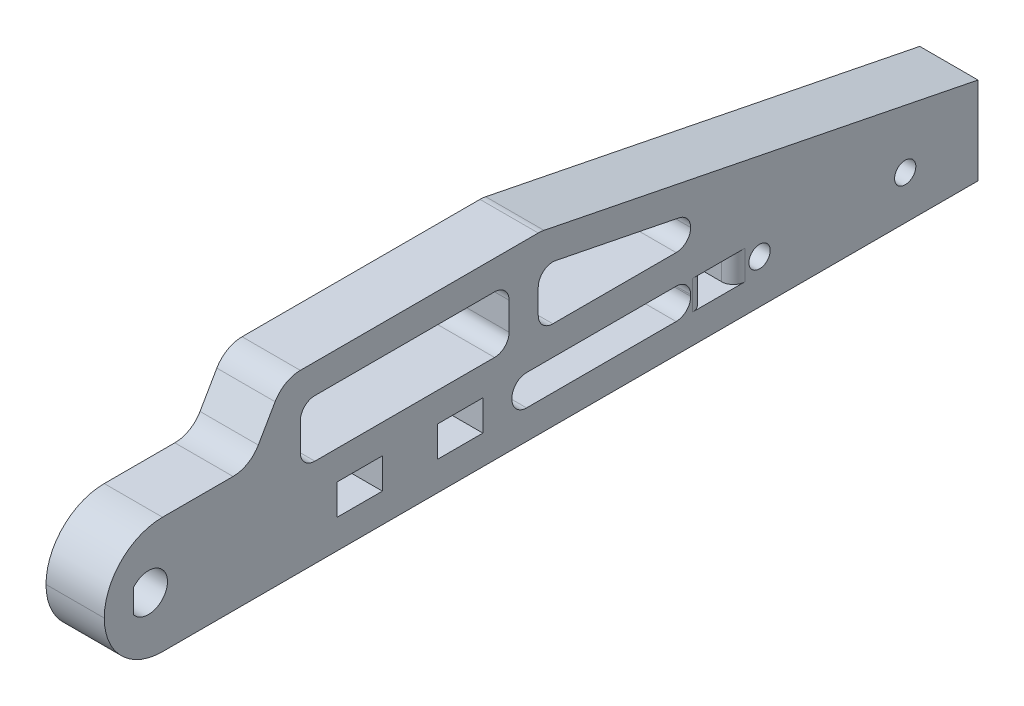
from build123d import *

# Parameters (mm, degrees)
BOSS_EXTRUDE1_DEPTH     = 10
CUT_EXTRUDE2_DEPTH      = 154.297097168
FILLET1_R               = 10
FILLET2_R               = 5
CUT_EXTRUDE3_DEPTH      = 154.297097168
CUT_EXTRUDE3_DEPTH_BACK = 154.297097168
SKETCH3_W               = 7.75
SKETCH3_H               = 5.25
CUT_EXTRUDE6_DEPTH      = 154.297097168
CUT_EXTRUDE6_DEPTH_BACK = 154.297097168
SKETCH6_R               = 1.825
FILLET3_R               = 5
CUT_EXTRUDE7_DEPTH      = 154.297097168
CUT_EXTRUDE7_DEPTH_BACK = 154.297097168
SKETCH7_W               = 35.844648394
SKETCH7_H               = 9.75
SKETCH7_W_2             = 30.675
SKETCH7_H_2             = 5.25
FILLET4_R               = 2.5
SKETCH8_W               = 5
SKETCH8_H               = 5
CUT_EXTRUDE8_DEPTH      = 10
FILLET5_R               = 2
FILLET6_R               = 2
FILLET7_R               = 2
FILLET8_R               = 2


# Some blends are built 0.0001 mm under size
with BuildPart() as part:
    # Sketch1 → Boss-Extrude1 (new body)
    with BuildSketch(Plane(origin=(0, 0, 0), x_dir=(0, 0, -1), z_dir=(1, 0, 0))):
        Polygon((0, 0), (150, 0), (150, 15), (75, 30), (30.773502692, 30), (25, 20), (0, 20), align=None)
    extrude(amount=-BOSS_EXTRUDE1_DEPTH)

    # Sketch2 → Cut-Extrude2 (cut, through all)
    with BuildSketch(Plane(origin=(0, 0, 0), x_dir=(0, 0, -1), z_dir=(1, 0, 0))):
        with BuildLine():
            Line((5, 11.994492417), (5, 8.005507583))
            ThreePointArc((5, 8.005507583), (10.85, 10), (5, 11.994492417))
        make_face()
    extrude(amount=-CUT_EXTRUDE2_DEPTH, mode=Mode.SUBTRACT)

    # Fillet1
    fillet1_edges = [part.edges().sort_by_distance(p)[0] for p in [
        (-5, 0, 0),
        (-5, 20, 0),
    ]]
    fillet(fillet1_edges, radius=FILLET1_R - 0.0001)  # a hair under: the kernel refuses the full size

    # Fillet2
    fillet2_edges = [part.edges().sort_by_distance(p)[0] for p in [
        (-5, 30, -30.773502692),
        (-5, 30, -75),
    ]]
    fillet(fillet2_edges, radius=FILLET2_R)

    # Sketch3 → Cut-Extrude3 (cut, two sides: drawn at the far end of the back side and taken through both)
    with BuildSketch(Plane(origin=(0, 0, 0), x_dir=(0, 0, -1), z_dir=(1, 0, 0)).offset(-CUT_EXTRUDE3_DEPTH_BACK)):
        with Locations((61.125, 7.625)):
            Rectangle(SKETCH3_W, SKETCH3_H)
        with Locations((43.875, 7.625)):
            Rectangle(SKETCH3_W, SKETCH3_H)
    extrude(amount=CUT_EXTRUDE3_DEPTH + CUT_EXTRUDE3_DEPTH_BACK, mode=Mode.SUBTRACT)

    # Sketch6 → Cut-Extrude6 (cut, two sides: drawn at the far end of the back side and taken through both)
    with BuildSketch(Plane(origin=(0, 0, 0), x_dir=(0, 0, -1), z_dir=(1, 0, 0)).offset(-CUT_EXTRUDE6_DEPTH_BACK)):
        with Locations((112.5, 7.5)):
            Circle(SKETCH6_R)
        with Locations((137.5, 7.5)):
            Circle(SKETCH6_R)
    extrude(amount=CUT_EXTRUDE6_DEPTH + CUT_EXTRUDE6_DEPTH_BACK, mode=Mode.SUBTRACT)

    # Fillet3
    fillet3_edges = [part.edges().sort_by_distance(p)[0] for p in [
        (-5, 20, -25),
    ]]
    fillet(fillet3_edges, radius=FILLET3_R)

    # Sketch7 → Cut-Extrude7 (cut, two sides: drawn at the far end of the back side and taken through both)
    with BuildSketch(Plane(origin=(0, 0, 0), x_dir=(0, 0, -1), z_dir=(1, 0, 0)).offset(-CUT_EXTRUDE7_DEPTH_BACK)):
        with Locations((51.582578235, 20.125)):
            Rectangle(SKETCH7_W, SKETCH7_H)
        with Locations((85.3375, 7.625)):
            Rectangle(SKETCH7_W_2, SKETCH7_H_2)
        Polygon((100.675, 15.25), (100.675, 19.765980486), (74.504902432, 25), (74.504902432, 15.25), align=None)
    extrude(amount=CUT_EXTRUDE7_DEPTH + CUT_EXTRUDE7_DEPTH_BACK, mode=Mode.SUBTRACT)

    # Fillet4
    # the kernel refuses this fillet: 2.5 mm, written as the material it adds along each edge
    with BuildSketch(Plane(origin=(0, 15.25, -69.504902432), x_dir=(0, 0, 1), z_dir=(-1, 0, 0)), Plane(origin=(-10, 25, -33.660254038), x_dir=(0, -1, 0), z_dir=(1, 0, 0)), Plane(origin=(0, 25, -69.504902432), x_dir=(0, -1, 0), z_dir=(-1, 0, 0)), Plane(origin=(0, 15.25, -74.504902432), x_dir=(0, 1, 0), z_dir=(-1, 0, 0)), Plane(origin=(0, 15.25, -100.675), x_dir=(0, 0, 1), z_dir=(-1, 0, 0)), Plane(origin=(0, 5, -100.675), x_dir=(0, 0, 1), z_dir=(-1, 0, 0))) as fillet4_piece_1:
        with BuildLine():
            CenterArc((FILLET4_R, FILLET4_R), FILLET4_R, 180, 90)
            Line((0, FILLET4_R), (0, 0))
            Line((0, 0), (FILLET4_R, 0))
        make_face()
    extrude(amount=10)
    with BuildSketch(Plane(origin=(-10, 15.25, -33.660254038), x_dir=(0, 1, 0), z_dir=(1, 0, 0)), Plane(origin=(-10, 5, -70), x_dir=(0, 1, 0), z_dir=(1, 0, 0)), Plane(origin=(-10, 10.25, -70), x_dir=(0, 0, -1), z_dir=(1, 0, 0)), Plane(origin=(0, 10.25, -100.675), x_dir=(0, 0, 1), z_dir=(-1, 0, 0))) as fillet4_piece_2:
        with BuildLine():
            CenterArc((FILLET4_R, -FILLET4_R), FILLET4_R, 90, 90)
            Line((0, -FILLET4_R), (0, 0))
            Line((0, 0), (FILLET4_R, 0))
        make_face()
    extrude(amount=10)
    with BuildSketch(Plane(origin=(-10, 25, -74.504902432), x_dir=(0, -0.1961161351381845, -0.9805806756909201), z_dir=(1, 0, 0))) as fillet4_piece_3:
        with BuildLine():
            CenterArc((FILLET4_R * 1.21980390272, -FILLET4_R), FILLET4_R, 90, 101.309932474)
            Line((FILLET4_R * 0.239223227028, -FILLET4_R * 1.19611613514), (0, 0))
            Line((0, 0), (FILLET4_R * 1.21980390272, 0))
        make_face()
    extrude(amount=10)
    with BuildSketch(Plane(origin=(-10, 19.765980486, -100.675), x_dir=(0, 0.19611613513818169, 0.9805806756909206), z_dir=(1, 0, 0))) as fillet4_piece_4:
        with BuildLine():
            CenterArc((FILLET4_R * 0.819803902719, FILLET4_R), FILLET4_R, 191.309932474, 78.690067526)
            Line((-FILLET4_R * 0.160776772972, FILLET4_R * 0.803883864862), (0, 0))
            Line((0, 0), (FILLET4_R * 0.819803902719, 0))
        make_face()
    extrude(amount=10)

    # Sketch8 → Cut-Extrude8 (cut)
    with BuildSketch(Plane(origin=(0, 0, 0), x_dir=(0, 0, -1), z_dir=(1, 0, 0))):
        with Locations((105.5, 7.5)):
            Rectangle(SKETCH8_W, SKETCH8_H)
    extrude(amount=-CUT_EXTRUDE8_DEPTH, mode=Mode.SUBTRACT)

    # Fillet5
    fillet5_edges = [part.edges().sort_by_distance(p)[0] for p in [
        (0, 7.5, -103),
    ]]
    fillet(fillet5_edges, radius=FILLET5_R)

    # Fillet6
    fillet6_edges = [part.edges().sort_by_distance(p)[0] for p in [
        (-10, 7.5, -108),
    ]]
    fillet(fillet6_edges, radius=FILLET6_R)

    # Fillet7
    fillet7_edges = [part.edges().sort_by_distance(p)[0] for p in [
        (-10, 7.5, -103),
    ]]
    fillet(fillet7_edges, radius=FILLET7_R)

    # Fillet8
    fillet8_edges = [part.edges().sort_by_distance(p)[0] for p in [
        (0, 7.5, -108),
    ]]
    fillet(fillet8_edges, radius=FILLET8_R)


solid = part.part
